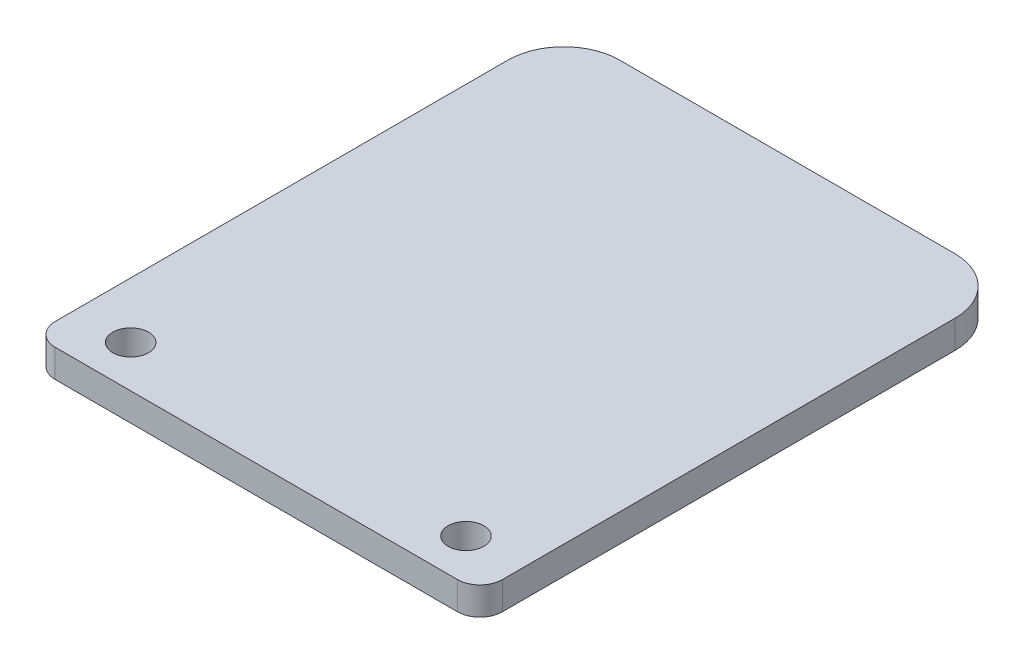
from build123d import *

# Parameters (mm, degrees)
SKETCH1_W           = 50.8
SKETCH1_H           = 60.325
BOSS_EXTRUDE1_DEPTH = 3.175
SKETCH2_R           = 2.032
CUT_EXTRUDE1_DEPTH  = 40.560296147
FILLET1_R           = 2.54
FILLET2_R           = 6.35


with BuildPart() as part:
    # Sketch1 → Boss-Extrude1 (new body)
    with BuildSketch(Plane(origin=(0, 0, 0), x_dir=(1, 0, 0), z_dir=(0, 1, 0))):
        Rectangle(SKETCH1_W, SKETCH1_H)
    extrude(amount=BOSS_EXTRUDE1_DEPTH)

    # Sketch2 → Cut-Extrude1 (cut, through all)
    with BuildSketch(Plane(origin=(0, 0, 0), x_dir=(-1, 0, 0), z_dir=(0, -1, 0))):
        with Locations((-19.05, -25.4)):
            Circle(SKETCH2_R)
        with Locations((19.05, -25.4)):
            Circle(SKETCH2_R)
    extrude(amount=-CUT_EXTRUDE1_DEPTH, mode=Mode.SUBTRACT)

    # Fillet1
    fillet1_edges = [part.edges().sort_by_distance(p)[0] for p in [
        (-25.4, 1.5875, 30.1625),
        (25.4, 1.5875, 30.1625),
    ]]
    fillet(fillet1_edges, radius=FILLET1_R)

    # Fillet2
    fillet2_edges = [part.edges().sort_by_distance(p)[0] for p in [
        (25.4, 1.5875, -30.1625),
        (-25.4, 1.5875, -30.1625),
    ]]
    fillet(fillet2_edges, radius=FILLET2_R)


solid = part.part
